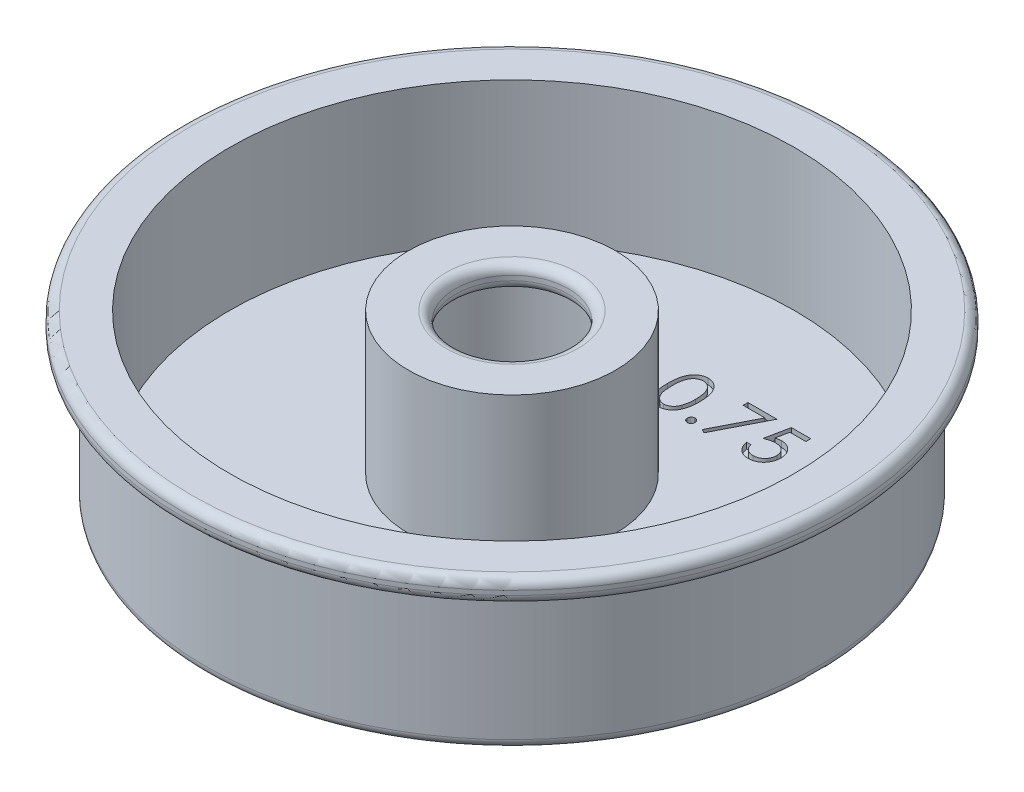
from build123d import *

# Parameters (mm, degrees)
CUT_EXTRUDE1_DEPTH = 0.79375


with BuildPart() as part:
    # Sketch1 → Revolve2 (revolve)
    with BuildSketch(Plane.XY):
        with BuildLine():
            Line((13.97, -3.138174804), (13.97, 15.911825196))
            Line((13.97, 15.911825196), (8.89, 15.911825196))
            ThreePointArc((8.89, 15.911825196), (7.991974388, 15.539850808), (7.62, 14.641825196))
            Line((7.62, 14.641825196), (7.62, 14.006825196))
            ThreePointArc((7.62, 14.006825196), (7.991974388, 13.108799584), (8.89, 12.736825196))
            Line((8.89, 12.736825196), (9.525, 12.736825196))
            ThreePointArc((9.525, 12.736825196), (10.423025612, 12.364850808), (10.795, 11.466825196))
            Line((10.795, 11.466825196), (10.795, -5.043174804))
            ThreePointArc((10.795, -5.043174804), (11.166974388, -5.941200416), (12.065, -6.313174804))
            Line((12.065, -6.313174804), (40.005, -6.313174804))
            ThreePointArc((40.005, -6.313174804), (40.903025612, -5.941200416), (41.275, -5.043174804))
            Line((41.275, -5.043174804), (41.275, 11.503650391))
            ThreePointArc((41.275, 11.503650391), (41.646974388, 12.401676004), (42.545, 12.773650391))
            Line((42.545, 12.773650391), (43.18, 12.773650391))
            ThreePointArc((43.18, 12.773650391), (44.078025612, 13.145624779), (44.45, 14.043650391))
            Line((44.45, 14.043650391), (44.45, 14.641825196))
            ThreePointArc((44.45, 14.641825196), (44.078025612, 15.539850808), (43.18, 15.911825196))
            Line((43.18, 15.911825196), (38.1, 15.911825196))
            Line((38.1, 15.911825196), (38.1, -3.138174804))
            Line((38.1, -3.138174804), (13.97, -3.138174804))
        make_face()
    revolve(axis=Axis((0, 0, 0), (0, 1, 0)))

    # Sketch2 → Cut-Extrude1 (cut)
    # profile 1 of 6: a face of its own
    with BuildSketch(Plane(origin=(0, -3.138174804, 0), x_dir=(1, 0, 0), z_dir=(0, 1, 0))):
        with BuildLine():
            Line((-13.231397678, 22.746779149), (-13.801269473, 22.746779149))
            add(Edge.make_bspline(
                [(-13.801269473, 22.746779149), (-13.785830717, 22.810700941), (-13.755649211, 22.935662817), (-13.692697899, 23.114201705), (-13.624119251, 23.283154379), (-13.541770447, 23.439357256), (-13.451947421, 23.585949551), (-13.349036198, 23.719606391), (-13.237784701, 23.843727057), (-13.114730864, 23.953878216), (-12.98568315, 24.053623525), (-12.848823197, 24.138668272), (-12.706904518, 24.211827806), (-12.558943834, 24.272098798), (-12.404500637, 24.317502248), (-12.244971177, 24.350443881), (-12.079937399, 24.371836332), (-11.967909627, 24.373924145), (-11.911025082, 24.374984277)],
                knots=[0, 0, 0, 0, 1.162005537, 2.271625781, 3.343758855, 4.383309926, 5.390229558, 6.379919256, 7.361854164, 8.333198761, 9.295911338, 10.242430842, 11.177959212, 12.116337295, 13.062827104, 14.020064771, 14.994644689, 16, 16, 16, 16], degree=3))
            add(Edge.make_bspline(
                [(-11.911025082, 24.374984277), (-11.828143536, 24.372481959), (-11.66418833, 24.367531907), (-11.423318231, 24.322330001), (-11.191041002, 24.250801546), (-10.969899081, 24.151970641), (-10.764488496, 24.030073659), (-10.581724271, 23.884994779), (-10.424083687, 23.719533189), (-10.291832459, 23.536775537), (-10.188282104, 23.341457684), (-10.111925398, 23.140434542), (-10.065440348, 22.934182965), (-10.059415909, 22.79492333), (-10.056397678, 22.72515455)],
                knots=[0, 0, 0, 0, 1.083050992, 2.142477498, 3.193116406, 4.255571735, 5.30263384, 6.308962982, 7.297363603, 8.282367274, 9.249857812, 10.179914175, 11.08814088, 12, 12, 12, 12], degree=3))
            add(Edge.make_bspline(
                [(-10.056397678, 22.72515455), (-10.058508765, 22.658013651), (-10.062639834, 22.52662933), (-10.097716699, 22.334820328), (-10.156746776, 22.154041996), (-10.238516203, 21.983533317), (-10.344364444, 21.824375393), (-10.472584908, 21.676210134), (-10.624082595, 21.538380376), (-10.738888668, 21.459423617), (-10.797994233, 21.418774341)],
                knots=[0, 0, 0, 0, 1.024540389, 2.004866551, 2.965041327, 3.920577974, 4.882998113, 5.874504559, 6.905732034, 8, 8, 8, 8], degree=3))
            add(Edge.make_bspline(
                [(-10.797994233, 21.418774341), (-10.730445192, 21.386156801), (-10.596611006, 21.321532021), (-10.414183617, 21.194793718), (-10.248579471, 21.04846006), (-10.156225581, 20.934264104), (-10.109823159, 20.876887322)],
                knots=[0, 0, 0, 0, 1.015518401, 2.012035669, 3.001164323, 4, 4, 4, 4], degree=3))
            add(Edge.make_bspline(
                [(-10.109823159, 20.876887322), (-10.079268152, 20.835053973), (-10.018658498, 20.752072324), (-9.943845458, 20.618656237), (-9.875974636, 20.483761392), (-9.82308781, 20.343772184), (-9.782132366, 20.200311145), (-9.752856993, 20.053131941), (-9.734670337, 19.902114386), (-9.732065836, 19.799947457), (-9.730756652, 19.74859205)],
                knots=[0, 0, 0, 0, 1.025084078, 2.033381695, 3.024893161, 4.013698104, 4.991890475, 5.976764909, 6.982997093, 8, 8, 8, 8], degree=3))
            add(Edge.make_bspline(
                [(-9.730756652, 19.74859205), (-9.734012413, 19.659674413), (-9.740508612, 19.482257586), (-9.798573146, 19.220139163), (-9.88858574, 18.963915752), (-10.016414753, 18.7188514), (-10.172202947, 18.489561281), (-10.357545521, 18.284408548), (-10.570336576, 18.108062509), (-10.807655396, 17.960723953), (-11.064770758, 17.842944294), (-11.339772189, 17.761197219), (-11.628697287, 17.707955191), (-11.826830527, 17.702245872), (-11.92756154, 17.699343252)],
                knots=[0, 0, 0, 0, 0.955779014, 1.907060117, 2.875433937, 3.871313158, 4.872415639, 5.851225146, 6.836215519, 7.83643374, 8.849228613, 9.86973379, 10.916971861, 12, 12, 12, 12], degree=3))
            add(Edge.make_bspline(
                [(-11.92756154, 17.699343252), (-11.995450842, 17.700918438), (-12.12903435, 17.704017881), (-12.325418983, 17.7252062), (-12.512874066, 17.763904924), (-12.691653051, 17.815980921), (-12.86191476, 17.882005939), (-13.023139636, 17.964227005), (-13.176319586, 18.060949302), (-13.320009111, 18.173314525), (-13.454191084, 18.29901067), (-13.575299598, 18.44026916), (-13.685353794, 18.594478736), (-13.781406867, 18.763430566), (-13.86783391, 18.944941247), (-13.93891936, 19.141334951), (-14.001486034, 19.350855963), (-14.030575319, 19.496865577), (-14.045500242, 19.571779149)],
                knots=[0, 0, 0, 0, 1.048658725, 2.063410685, 3.046034179, 4.001477787, 4.936774919, 5.862367409, 6.792675028, 7.730719943, 8.675894397, 9.627829632, 10.600096036, 11.597688215, 12.626045268, 13.701542398, 14.82072376, 16, 16, 16, 16], degree=3))
            Line((-14.045500242, 19.571779149), (-13.475628447, 19.571779149))
            add(Edge.make_bspline(
                [(-13.475628447, 19.571779149), (-13.460781619, 19.522885939), (-13.431903247, 19.427784399), (-13.382746449, 19.29091413), (-13.326742584, 19.165441662), (-13.266663313, 19.05044657), (-13.203565276, 18.944796354), (-13.132962483, 18.851284677), (-13.060084177, 18.765804239), (-13.005148779, 18.717644729), (-12.978262662, 18.694074822)],
                knots=[0, 0, 0, 0, 1.198163088, 2.33053128, 3.407730985, 4.417276592, 5.372219308, 6.28897303, 7.162600585, 8, 8, 8, 8], degree=3))
            add(Edge.make_bspline(
                [(-12.978262662, 18.694074822), (-12.942708873, 18.666663988), (-12.871711042, 18.61192693), (-12.756017251, 18.542073975), (-12.634342387, 18.481547544), (-12.504050049, 18.435312839), (-12.367951823, 18.396164797), (-12.223847889, 18.370546141), (-12.073009595, 18.35296903), (-11.970016652, 18.35141794), (-11.917385258, 18.350625303)],
                knots=[0, 0, 0, 0, 0.946170439, 1.889420265, 2.845303464, 3.807233317, 4.801018734, 5.828864929, 6.890507805, 8, 8, 8, 8], degree=3))
            add(Edge.make_bspline(
                [(-11.917385258, 18.350625303), (-11.857961046, 18.351742731), (-11.74176213, 18.353927765), (-11.572208314, 18.374022262), (-11.410904802, 18.40328744), (-11.259642493, 18.448486709), (-11.116440001, 18.504331968), (-10.983304723, 18.574451218), (-10.85848893, 18.656719499), (-10.743591295, 18.750226258), (-10.640275874, 18.852590971), (-10.549308471, 18.959657543), (-10.471975157, 19.070974547), (-10.409593522, 19.187157995), (-10.360334667, 19.307726768), (-10.32680086, 19.433019215), (-10.30348454, 19.56200997), (-10.301585686, 19.649692528), (-10.300628447, 19.693894534)],
                knots=[0, 0, 0, 0, 1.217147791, 2.380027433, 3.494444702, 4.572153297, 5.609568379, 6.639424714, 7.649109417, 8.668170816, 9.669597737, 10.625200337, 11.543417969, 12.441394052, 13.322311151, 14.205496177, 15.095365482, 16, 16, 16, 16], degree=3))
            add(Edge.make_bspline(
                [(-10.300628447, 19.693894534), (-10.303404852, 19.75306082), (-10.308943845, 19.871098989), (-10.351232268, 20.044758017), (-10.420789921, 20.212077636), (-10.518167192, 20.370203141), (-10.636704871, 20.516753705), (-10.77525263, 20.647511966), (-10.934960988, 20.755407703), (-11.081954179, 20.829954265), (-11.212156677, 20.88082153), (-11.323581732, 20.914703252), (-11.448325855, 20.943393741), (-11.584880516, 20.970086005), (-11.734274638, 20.992803308), (-11.896345575, 21.011747746), (-12.071126171, 21.026906177), (-12.192123001, 21.03367545), (-12.254474601, 21.037163764)],
                knots=[0, 0, 0, 0, 1.07054697, 2.135767047, 3.216561865, 4.33974944, 5.486079747, 6.621378074, 7.775625952, 8.963672916, 9.598146892, 10.304877434, 11.070270905, 11.915000392, 12.823868403, 13.805723172, 14.86925407, 16, 16, 16, 16], degree=3))
            Line((-12.254474601, 21.037163764), (-12.254474601, 21.688445816))
            add(Edge.make_bspline(
                [(-12.254474601, 21.688445816), (-12.175913915, 21.68977896), (-12.022032829, 21.692390261), (-11.797253162, 21.723973365), (-11.582308724, 21.767662505), (-11.381963064, 21.834582782), (-11.199357541, 21.912307321), (-11.040934834, 22.002753472), (-10.908914438, 22.10329166), (-10.803937923, 22.21547368), (-10.724963465, 22.335788124), (-10.667220561, 22.461185488), (-10.633111398, 22.592764856), (-10.628558145, 22.682562325), (-10.626269473, 22.72769862)],
                knots=[0, 0, 0, 0, 1.321986639, 2.589447074, 3.816329219, 5.01088745, 6.139805852, 7.153945165, 8.075214402, 8.924034688, 9.728124013, 10.488707548, 11.240355623, 12, 12, 12, 12], degree=3))
            add(Edge.make_bspline(
                [(-10.626269473, 22.72769862), (-10.627021333, 22.760859672), (-10.628517122, 22.826832012), (-10.647380755, 22.923216065), (-10.675727229, 23.016653496), (-10.714697595, 23.106746951), (-10.76685867, 23.192871591), (-10.82928096, 23.275761677), (-10.903608799, 23.354943962), (-10.988781253, 23.428749685), (-11.080242671, 23.499088158), (-11.180481548, 23.558802899), (-11.286475521, 23.609866083), (-11.398341937, 23.651974751), (-11.516443828, 23.683650888), (-11.640226297, 23.706394486), (-11.76992538, 23.720614231), (-11.858411237, 23.7226615), (-11.90339287, 23.723702226)],
                knots=[0, 0, 0, 0, 0.884392785, 1.759457502, 2.611959086, 3.489218968, 4.37281399, 5.2945488, 6.255912374, 7.266815255, 8.301784654, 9.332968512, 10.37626691, 11.440494194, 12.520033166, 13.637162961, 14.798855837, 16, 16, 16, 16], degree=3))
            add(Edge.make_bspline(
                [(-11.90339287, 23.723702226), (-11.975695182, 23.721177898), (-12.116918414, 23.716247298), (-12.320508334, 23.67306183), (-12.509773412, 23.604158736), (-12.654442136, 23.521911686), (-12.761271949, 23.440721614), (-12.837611537, 23.369814998), (-12.912578748, 23.291015447), (-12.981241619, 23.199469537), (-13.050681548, 23.101376932), (-13.113899538, 22.99175111), (-13.175330694, 22.873451709), (-13.212346749, 22.789821058), (-13.231397678, 22.746779149)],
                knots=[0, 0, 0, 0, 1.472543308, 2.876219568, 4.221790263, 5.565193594, 6.249813518, 6.953379497, 7.687249741, 8.463570142, 9.283606569, 10.136032583, 11.040678096, 12, 12, 12, 12], degree=3))
        make_face()
    # profile 2 of 6: a face of its own
    with BuildSketch(Plane(origin=(0, -3.138174804, 0), x_dir=(1, 0, 0), z_dir=(0, 1, 0))):
        Polygon((-6.718577165, 22.50254838), (-6.040582374, 22.50254838), (-4.846141268, 20.828549982), (-3.651700162, 22.50254838), (-2.97370537, 22.50254838), (-4.506507854, 20.354080832), (-2.729474601, 17.862163764), (-3.407469393, 17.862163764), (-4.846141268, 19.878339646), (-6.284813143, 17.862163764), (-6.962807935, 17.862163764), (-5.184502646, 20.354080832), align=None)
    # profile 3 of 6: a face of its own
    with BuildSketch(Plane(origin=(0, -3.138174804, 0), x_dir=(1, 0, 0), z_dir=(0, 1, 0))):
        with BuildLine():
            add(Edge.make_bspline(
                [(-0.04293614, 21.034619694), (-0.042341021, 21.136396383), (-0.041184994, 21.334099069), (-0.028324574, 21.622179776), (-0.006960738, 21.892436301), (0.022317067, 22.144881578), (0.057945974, 22.379580779), (0.105508357, 22.595906696), (0.159597298, 22.794860553), (0.222285307, 22.977091127), (0.293020296, 23.145053531), (0.370008169, 23.301853539), (0.456304296, 23.447253902), (0.546976695, 23.583575322), (0.645695739, 23.708586311), (0.749652116, 23.824052284), (0.862903235, 23.927304646), (0.981599264, 24.021368652), (1.106814849, 24.103826979), (1.234980829, 24.176457805), (1.366979379, 24.238506135), (1.503170882, 24.287293069), (1.642331237, 24.327589891), (1.784946915, 24.355146982), (1.93125339, 24.372485944), (2.030007564, 24.374143598), (2.080090703, 24.374984277)],
                knots=[0, 0, 0, 0, 1.646270934, 3.197905019, 4.663502075, 6.030701355, 7.308322542, 8.50163776, 9.611534131, 10.641858119, 11.616356847, 12.558055219, 13.465016945, 14.349605745, 15.204443733, 16.039544428, 16.859896111, 17.680448484, 18.487036065, 19.28249412, 20.06191084, 20.843045899, 21.620316918, 22.403196591, 23.190181807, 24, 24, 24, 24], degree=3))
            add(Edge.make_bspline(
                [(2.080090703, 24.374984277), (2.130592214, 24.374099241), (2.23102383, 24.372339183), (2.379505654, 24.355422887), (2.524557219, 24.327353849), (2.665560128, 24.287582938), (2.803672604, 24.238242211), (2.937814372, 24.176398441), (3.068818649, 24.104409639), (3.194603599, 24.019820604), (3.316550115, 23.925509903), (3.431662848, 23.818897633), (3.539952275, 23.701060285), (3.642777472, 23.573258618), (3.737221199, 23.433041392), (3.827161568, 23.282847364), (3.907665119, 23.120049938), (3.98519803, 22.947365375), (4.052121563, 22.760015594), (4.112476037, 22.559056672), (4.161242165, 22.342114933), (4.201862702, 22.110328602), (4.233331299, 21.862846454), (4.256250521, 21.600198995), (4.268357404, 21.32221343), (4.270637419, 21.13215276), (4.27180745, 21.034619694)],
                knots=[0, 0, 0, 0, 0.810914788, 1.612654377, 2.396697861, 3.181598691, 3.963628158, 4.749916497, 5.551656086, 6.361998678, 7.18212741, 8.025565596, 8.878627764, 9.750805457, 10.657531673, 11.591944965, 12.560506719, 13.57287815, 14.630710178, 15.753379473, 16.941251878, 18.199788006, 19.531962791, 20.947069417, 22.433333509, 24, 24, 24, 24], degree=3))
            add(Edge.make_bspline(
                [(4.27180745, 21.034619694), (4.27062529, 20.937512032), (4.268321898, 20.748301714), (4.256386244, 20.471566944), (4.232875585, 20.210313352), (4.203466035, 19.96391437), (4.162733573, 19.733395547), (4.112649914, 19.51795919), (4.057041472, 19.316674946), (3.988398345, 19.131191788), (3.913267485, 18.958922234), (3.831524486, 18.798054693), (3.74394923, 18.647167276), (3.648538221, 18.507467735), (3.546841315, 18.377966458), (3.436681898, 18.260949342), (3.321165265, 18.153596837), (3.198859882, 18.058071742), (3.07111321, 17.974460739), (2.940558885, 17.899687039), (2.804880461, 17.839393435), (2.667152675, 17.787622718), (2.525405497, 17.74807047), (2.379815617, 17.720722189), (2.231123589, 17.701541835), (2.13060932, 17.70007865), (2.080090703, 17.699343252)],
                knots=[0, 0, 0, 0, 1.561518951, 3.042555995, 4.452378317, 5.7783523, 7.031515105, 8.214008947, 9.334062868, 10.386615937, 11.391082383, 12.354592575, 13.286541444, 14.194233754, 15.072674879, 15.931287219, 16.775624067, 17.606195743, 18.42308326, 19.229000347, 20.022332153, 20.807536673, 21.593273796, 22.3848459, 23.188221202, 24, 24, 24, 24], degree=3))
            add(Edge.make_bspline(
                [(2.080090703, 17.699343252), (2.030008954, 17.700189354), (1.931257519, 17.701857702), (1.784930975, 17.719118329), (1.642904257, 17.746868742), (1.504476517, 17.785724581), (1.368937554, 17.833285784), (1.238134291, 17.895250324), (1.110612351, 17.966613563), (0.986711956, 18.047885256), (0.868761321, 18.140997453), (0.756096709, 18.243984091), (0.65154846, 18.359415137), (0.554240886, 18.485467941), (0.461759326, 18.620982823), (0.376688606, 18.767810014), (0.298001485, 18.925367322), (0.226076866, 19.094672674), (0.162307148, 19.278196615), (0.105977735, 19.478038696), (0.061502049, 19.695962778), (0.023432973, 19.930218573), (-0.007272693, 20.181812704), (-0.028235541, 20.450881758), (-0.041191926, 20.737258066), (-0.042344126, 20.933690371), (-0.04293614, 21.034619694)],
                knots=[0, 0, 0, 0, 0.810891512, 1.598919785, 2.382837074, 3.152667961, 3.926044502, 4.706494248, 5.493654104, 6.291793342, 7.103789334, 7.925228297, 8.761435821, 9.622817696, 10.50288917, 11.416980706, 12.369136599, 13.353924996, 14.394355917, 15.514179734, 16.714354668, 17.994756427, 19.357759367, 20.818452758, 22.365282078, 24, 24, 24, 24], degree=3))
        make_face()
        with BuildLine():
            add(Edge.make_bspline(
                [(0.526935655, 21.037163764), (0.527152366, 20.952348268), (0.52757296, 20.787738044), (0.538560638, 20.548536699), (0.553528916, 20.325433388), (0.57283527, 20.118144829), (0.601506333, 19.927372663), (0.633631506, 19.75180481), (0.672725897, 19.592370394), (0.718981144, 19.447975366), (0.771666362, 19.316169199), (0.829189858, 19.19352128), (0.890985741, 19.078582767), (0.960144771, 18.972386077), (1.035464957, 18.874584894), (1.115245013, 18.783448184), (1.202462416, 18.702173661), (1.323119206, 18.604697795), (1.482407095, 18.503970224), (1.683104207, 18.416256604), (1.889331254, 18.361134147), (2.029305664, 18.35412419), (2.099171232, 18.350625303)],
                knots=[0, 0, 0, 0, 1.459021318, 2.831673884, 4.118529203, 5.306027144, 6.411944654, 7.436330062, 8.375795394, 9.233974572, 10.042671642, 10.816086306, 11.563610507, 12.285937304, 12.993564865, 13.685989202, 14.367179055, 15.041617293, 16.353048772, 17.594441528, 18.799311195, 20, 20, 20, 20], degree=3))
            add(Edge.make_bspline(
                [(2.099171232, 18.350625303), (2.169488722, 18.353524134), (2.309978523, 18.35931581), (2.515235551, 18.41519352), (2.714499041, 18.499502541), (2.870658133, 18.599193015), (2.989462176, 18.694131556), (3.074583001, 18.775075275), (3.15270986, 18.865709491), (3.226809053, 18.963498214), (3.294770519, 19.070309721), (3.356570783, 19.185630393), (3.412964856, 19.309780473), (3.445094126, 19.396448429), (3.461520992, 19.440759518)],
                knots=[0, 0, 0, 0, 1.353760809, 2.704726607, 4.075137775, 5.516104923, 6.260822281, 7.007110065, 7.778089737, 8.566572457, 9.372053459, 10.217411131, 11.088608312, 12, 12, 12, 12], degree=3))
            add(Edge.make_bspline(
                [(3.461520992, 19.440759518), (3.480664913, 19.497419188), (3.519535284, 19.612462617), (3.569630932, 19.790922386), (3.609083299, 19.978161686), (3.644576834, 20.173061541), (3.668803092, 20.377059284), (3.688302697, 20.589523723), (3.699788371, 20.810615052), (3.701212134, 20.960828822), (3.701935655, 21.037163764)],
                knots=[0, 0, 0, 0, 0.884706709, 1.796334032, 2.740027952, 3.714592787, 4.726048262, 5.777819803, 6.87074269, 8, 8, 8, 8], degree=3))
            add(Edge.make_bspline(
                [(3.701935655, 21.037163764), (3.700937455, 21.11348636), (3.698984761, 21.262789673), (3.691520812, 21.481444087), (3.672246613, 21.68912131), (3.65083964, 21.886716025), (3.61927611, 22.073134431), (3.585244089, 22.249937128), (3.53952189, 22.414933759), (3.490681727, 22.570707571), (3.434782866, 22.715488759), (3.373250034, 22.849952343), (3.307533414, 22.974747486), (3.23615535, 23.089531794), (3.159963182, 23.194819408), (3.076945914, 23.288499315), (2.990396552, 23.373474957), (2.869171086, 23.470471333), (2.710467732, 23.569371123), (2.512990629, 23.660386145), (2.307485317, 23.712652618), (2.168559193, 23.720021679), (2.099171232, 23.723702226)],
                knots=[0, 0, 0, 0, 1.31362396, 2.569729283, 3.763502607, 4.902122613, 5.988968491, 7.01645872, 7.998833611, 8.933434873, 9.825090667, 10.667526885, 11.477055099, 12.250526234, 12.991942729, 13.710640831, 14.402115721, 15.076753259, 16.378508321, 17.609869233, 18.806226677, 20, 20, 20, 20], degree=3))
            add(Edge.make_bspline(
                [(2.099171232, 23.723702226), (2.028939158, 23.720016601), (1.888347063, 23.712638638), (1.680705774, 23.660580878), (1.481670736, 23.569843068), (1.323387054, 23.470143764), (1.202077041, 23.375187113), (1.116655583, 23.292843118), (1.036561813, 23.202770628), (0.962778986, 23.104070011), (0.893674144, 22.99799713), (0.830208592, 22.883717514), (0.773027151, 22.760652039), (0.720259493, 22.628905077), (0.673863149, 22.484522507), (0.635592673, 22.325284476), (0.60023759, 22.150275043), (0.575209031, 21.95846965), (0.552959074, 21.751129172), (0.538660057, 21.527468895), (0.527536204, 21.287866376), (0.527139848, 21.122405046), (0.526935655, 21.037163764)],
                knots=[0, 0, 0, 0, 1.207732386, 2.417664972, 3.655092373, 4.956220595, 5.625982001, 6.301752483, 6.994047911, 7.697131622, 8.419323945, 9.170223765, 9.943494443, 10.752040957, 11.610060368, 12.549350801, 13.567764191, 14.679664412, 15.874934091, 17.154273443, 18.533957287, 20, 20, 20, 20], degree=3))
        make_face(mode=Mode.SUBTRACT)
    # profile 4 of 6: a face of its own
    with BuildSketch(Plane(origin=(0, -3.138174804, 0), x_dir=(1, 0, 0), z_dir=(0, 1, 0))):
        with BuildLine():
            add(Edge.make_bspline(
                [(5.85930745, 18.839086841), (5.894668264, 18.836985596), (5.963989005, 18.83286635), (6.064208566, 18.804605814), (6.154913163, 18.754425101), (6.235707378, 18.687545489), (6.302303414, 18.606454786), (6.354272453, 18.516473637), (6.382286812, 18.415415033), (6.386376052, 18.345692623), (6.388474117, 18.309920175)],
                knots=[0, 0, 0, 0, 1.020151414, 1.999887582, 2.974338812, 3.990962822, 5.007586832, 5.987933904, 6.967670073, 8, 8, 8, 8], degree=3))
            add(Edge.make_bspline(
                [(6.388474117, 18.309920175), (6.386304955, 18.275007276), (6.382027401, 18.206159554), (6.354336669, 18.105863186), (6.301907349, 18.015825802), (6.236166719, 17.93363478), (6.15489319, 17.866613486), (6.063994126, 17.816859703), (5.964224272, 17.786575683), (5.894707514, 17.782717972), (5.85930745, 17.780753508)],
                knots=[0, 0, 0, 0, 1.009421747, 1.99056486, 2.972319754, 3.999869655, 5.017953583, 5.993804169, 6.978383603, 8, 8, 8, 8], degree=3))
            add(Edge.make_bspline(
                [(5.85930745, 17.780753508), (5.823881878, 17.782646891), (5.754721883, 17.786343272), (5.655324436, 17.817481506), (5.563871793, 17.866146927), (5.482614088, 17.933759748), (5.416322861, 18.015402866), (5.366202523, 18.106483268), (5.336103253, 18.205872447), (5.332144712, 18.274950728), (5.330140783, 18.309920175)],
                knots=[0, 0, 0, 0, 1.022052826, 1.995314843, 2.982371812, 4.00089066, 5.028879526, 6.005146991, 6.990147033, 8, 8, 8, 8], degree=3))
            add(Edge.make_bspline(
                [(5.330140783, 18.309920175), (5.332067735, 18.345751192), (5.335829871, 18.415706856), (5.366265712, 18.515853808), (5.415933982, 18.606873691), (5.483072342, 18.687421772), (5.563852136, 18.754890164), (5.655103822, 18.803993431), (5.754961274, 18.833095322), (5.823922162, 18.837055031), (5.85930745, 18.839086841)],
                knots=[0, 0, 0, 0, 1.032775665, 2.016367738, 2.991239715, 4.008302682, 5.025365648, 6.011011707, 6.979408107, 8, 8, 8, 8], degree=3))
        make_face()
    # profile 5 of 6: a face of its own
    with BuildSketch(Plane(origin=(0, -3.138174804, 0), x_dir=(1, 0, 0), z_dir=(0, 1, 0))):
        Polygon((7.609627963, 24.212163764), (11.517320271, 24.212163764), (8.179499758, 17.699343252), (7.687222114, 17.970286761), (10.553117546, 23.560881713), (7.609627963, 23.560881713), align=None)
    # profile 6 of 6: a face of its own
    with BuildSketch(Plane(origin=(0, -3.138174804, 0), x_dir=(1, 0, 0), z_dir=(0, 1, 0))):
        with BuildLine():
            Line((16.07629463, 24.212163764), (16.07629463, 23.560881713))
            Line((16.07629463, 23.560881713), (13.916378764, 23.560881713))
            Line((13.916378764, 23.560881713), (13.57420128, 21.890699421))
            add(Edge.make_bspline(
                [(13.57420128, 21.890699421), (13.641431224, 21.909260057), (13.771678606, 21.945218354), (13.963920068, 21.985143109), (14.146423066, 22.009210415), (14.264851238, 22.012496649), (14.322158011, 22.014086841)],
                knots=[0, 0, 0, 0, 1.100273476, 2.13160584, 3.095893838, 4, 4, 4, 4], degree=3))
            add(Edge.make_bspline(
                [(14.322158011, 22.014086841), (14.393067082, 22.012552072), (14.532492031, 22.009534333), (14.736488406, 21.980556835), (14.931220941, 21.934945847), (15.116282384, 21.871227186), (15.292015097, 21.789748098), (15.456802245, 21.687966778), (15.613117315, 21.569070591), (15.758156022, 21.432373213), (15.889735838, 21.281929708), (16.005425562, 21.120171856), (16.103691976, 20.948671669), (16.182723631, 20.765790565), (16.245832352, 20.573550386), (16.287836685, 20.369928415), (16.315807, 20.156843969), (16.318931901, 20.011148535), (16.320525399, 19.936853268)],
                knots=[0, 0, 0, 0, 1.052922333, 2.070308379, 3.05430497, 4.020497103, 4.973039431, 5.925935799, 6.892292201, 7.88610001, 8.88166317, 9.857072816, 10.836096531, 11.812156883, 12.81219415, 13.836441305, 14.89672472, 16, 16, 16, 16], degree=3))
            add(Edge.make_bspline(
                [(16.320525399, 19.936853268), (16.319318762, 19.885105811), (16.316921796, 19.782310219), (16.304732358, 19.629648598), (16.281263273, 19.480218886), (16.24975326, 19.334001261), (16.208854873, 19.191272543), (16.159344732, 19.051624199), (16.098754796, 18.915925413), (16.032295016, 18.782892196), (15.95746212, 18.655532047), (15.874406828, 18.536426029), (15.786658008, 18.423787404), (15.692240066, 18.318824203), (15.590275403, 18.222226156), (15.481998892, 18.133419988), (15.36827453, 18.05090386), (15.247342876, 17.978027278), (15.121898657, 17.910965914), (14.99013032, 17.855950354), (14.855037335, 17.80676411), (14.714675347, 17.767558253), (14.569362287, 17.736837761), (14.418858623, 17.715972385), (14.263953693, 17.700775135), (14.158951884, 17.699823801), (14.105912017, 17.699343252)],
                knots=[0, 0, 0, 0, 1.056347294, 2.098418968, 3.122841568, 4.141288669, 5.149314143, 6.15115421, 7.162517403, 8.180376062, 9.185164535, 10.17417709, 11.141909838, 12.097768115, 13.052685741, 14.0056014, 14.954263652, 15.917497458, 16.885230207, 17.854509472, 18.828990115, 19.81800267, 20.826176721, 21.857883937, 22.917946725, 24, 24, 24, 24], degree=3))
            add(Edge.make_bspline(
                [(14.105912017, 17.699343252), (14.04264029, 17.700596629), (13.91816064, 17.703062501), (13.735787611, 17.728858896), (13.560319683, 17.765804858), (13.393169357, 17.821387805), (13.232838636, 17.891033325), (13.08148599, 17.979055522), (12.935244082, 18.078803325), (12.800057959, 18.196514822), (12.67458901, 18.325176131), (12.562272915, 18.46479928), (12.462244855, 18.613079839), (12.376106656, 18.770737919), (12.302631675, 18.937359254), (12.244910196, 19.113568127), (12.198322324, 19.298443848), (12.178612975, 19.42572236), (12.168602322, 19.490368893)],
                knots=[0, 0, 0, 0, 1.0467383, 2.05933395, 3.04377827, 4.011590433, 4.970194871, 5.932262533, 6.905835911, 7.896367577, 8.894135286, 9.877477877, 10.858688626, 11.851381753, 12.8477658, 13.868841284, 14.917554742, 16, 16, 16, 16], degree=3))
            Line((12.168602322, 19.490368893), (12.738474117, 19.490368893))
            add(Edge.make_bspline(
                [(12.738474117, 19.490368893), (12.752495928, 19.429814472), (12.779446628, 19.313425512), (12.838602772, 19.149901507), (12.91093086, 19.004179487), (12.996935892, 18.874331815), (13.099533805, 18.761104063), (13.216608626, 18.660198822), (13.347868067, 18.569166801), (13.493724355, 18.493288352), (13.647599513, 18.428575043), (13.808648594, 18.385482682), (13.972486479, 18.35518249), (14.083300094, 18.352149439), (14.138984934, 18.350625303)],
                knots=[0, 0, 0, 0, 1.136247022, 2.183929868, 3.172523383, 4.106158343, 5.02341133, 5.958108904, 6.928429099, 7.938127109, 8.96079061, 9.975095812, 10.982467395, 12, 12, 12, 12], degree=3))
            add(Edge.make_bspline(
                [(14.138984934, 18.350625303), (14.193338112, 18.352114428), (14.300359963, 18.355046529), (14.457860622, 18.377614451), (14.609921123, 18.412371759), (14.755041041, 18.464387067), (14.895759834, 18.527605342), (15.028517961, 18.608731265), (15.157156038, 18.702094442), (15.277675652, 18.809058613), (15.388055795, 18.926932202), (15.485584758, 19.052984044), (15.566822872, 19.18745318), (15.635283327, 19.328011615), (15.687268598, 19.476199854), (15.724354378, 19.631323415), (15.746131356, 19.79376545), (15.749127068, 19.904562627), (15.750653604, 19.961021937)],
                knots=[0, 0, 0, 0, 1.027316725, 2.022795036, 3.002884548, 3.971462791, 4.93288096, 5.914575861, 6.907176829, 7.935150275, 8.956128384, 9.956726525, 10.942570165, 11.921478529, 12.907843606, 13.90538589, 14.932640048, 16, 16, 16, 16], degree=3))
            add(Edge.make_bspline(
                [(15.750653604, 19.961021937), (15.749458934, 20.011959372), (15.747120538, 20.111662154), (15.728015074, 20.257529286), (15.694782853, 20.39554752), (15.648656671, 20.526383344), (15.590092421, 20.650160161), (15.51852554, 20.767005713), (15.432612947, 20.875379953), (15.334474806, 20.975333586), (15.226963789, 21.067580716), (15.108230142, 21.146219273), (14.98075856, 21.212375238), (14.846084858, 21.269467178), (14.701005685, 21.310471388), (14.548394081, 21.34125598), (14.386602054, 21.359063852), (14.275983805, 21.361534707), (14.219123155, 21.36280479)],
                knots=[0, 0, 0, 0, 1.045622112, 2.046656509, 3.013763289, 3.955457236, 4.890082067, 5.820317437, 6.762574623, 7.722996705, 8.69280354, 9.665887285, 10.63943826, 11.638615906, 12.663482002, 13.728887084, 14.832589034, 16, 16, 16, 16], degree=3))
            add(Edge.make_bspline(
                [(14.219123155, 21.36280479), (14.169903527, 21.361751432), (14.068277483, 21.359576514), (13.912388926, 21.343562727), (13.748573942, 21.317728579), (13.5774605, 21.28219353), (13.398534721, 21.235691433), (13.212174194, 21.179966554), (13.017987082, 21.113342356), (12.887144925, 21.063028197), (12.819884373, 21.037163764)],
                knots=[0, 0, 0, 0, 0.817624296, 1.688186739, 2.600797293, 3.572016777, 4.590301741, 5.671205678, 6.80286297, 8, 8, 8, 8], degree=3))
            Line((12.819884373, 21.037163764), (13.471166424, 24.212163764))
            Line((13.471166424, 24.212163764), (16.07629463, 24.212163764))
        make_face()
    extrude(amount=-CUT_EXTRUDE1_DEPTH, mode=Mode.SUBTRACT)


solid = part.part
